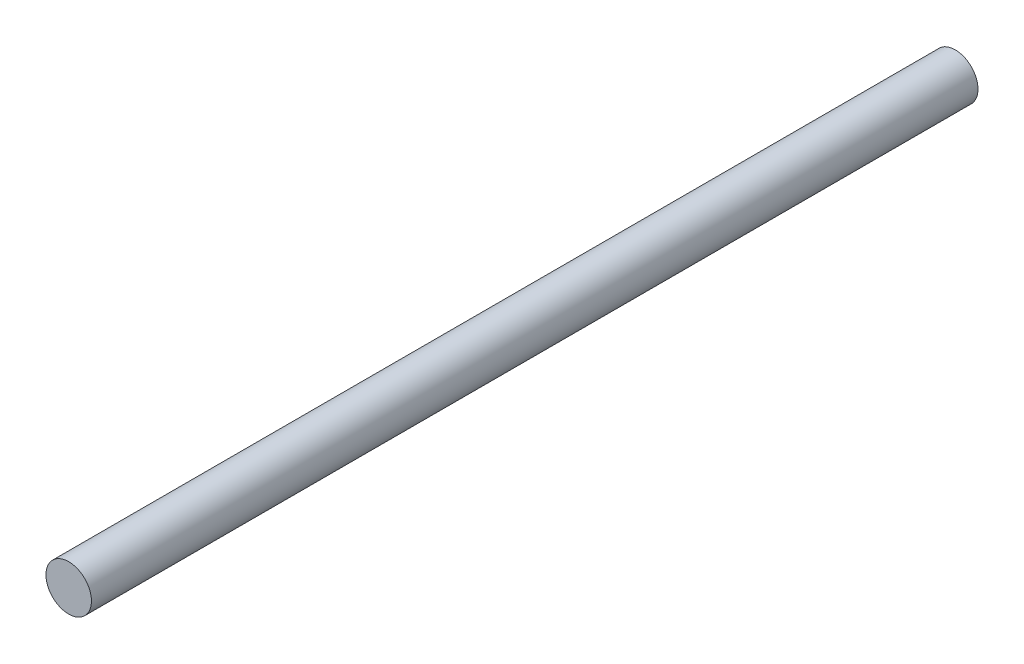
from build123d import *

# Parameters (mm, degrees)
SKETCH1_R           = 5
BOSS_EXTRUDE1_DEPTH = 195


with BuildPart() as part:
    # Sketch1 → Boss-Extrude1 (new body)
    with BuildSketch(Plane.XY):
        Circle(SKETCH1_R)
    extrude(amount=BOSS_EXTRUDE1_DEPTH)


solid = part.part
